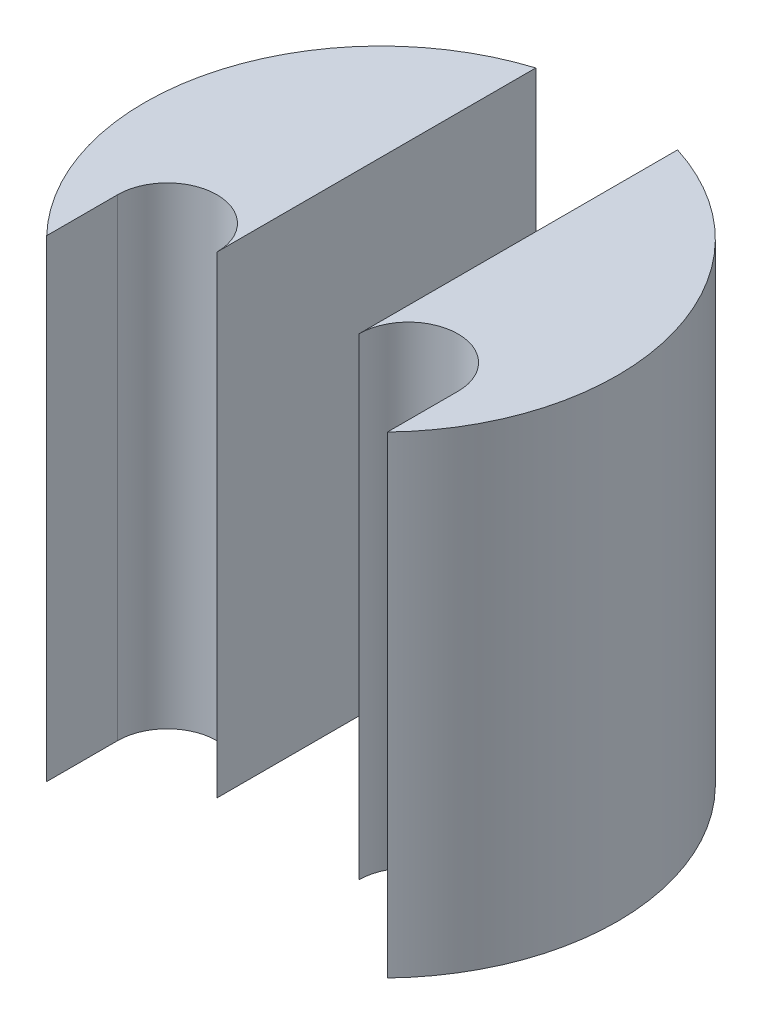
from build123d import *

# Parameters (mm, degrees)
BOSS_EXTRUDE2_DEPTH   = 200
BOSS_EXTRUDE2_2_DEPTH = 200


with BuildPart() as part:
    # Sketch2 → Boss-Extrude2 (new body)
    with BuildSketch(Plane(origin=(0, 0, 0), x_dir=(1, 0, 0), z_dir=(0, 1, 0))):
        with BuildLine():
            Line((-29.936750537, -39.462967992), (-29.936750537, 95.41378814))
            ThreePointArc((-29.936750537, 95.41378814), (-96.905308077, 24.685243904), (-71.936750537, -69.462967992))
            Line((-71.936750537, -69.462967992), (-71.936750537, -39.462967992))
            ThreePointArc((-71.936750537, -39.462967992), (-50.936750537, -18.462967992), (-29.936750537, -39.462967992))
        make_face()
    extrude(amount=BOSS_EXTRUDE2_DEPTH)


with BuildPart() as body_2:
    # Sketch2 → Boss-Extrude2 2 (new body)
    with BuildSketch(Plane(origin=(0, 0, 0), x_dir=(1, 0, 0), z_dir=(0, 1, 0))):
        with BuildLine():
            ThreePointArc((72.063249463, -69.331724894), (96.899173876, 24.709312052), (30.063249463, 95.374006059))
            Line((30.063249463, 95.374006059), (30.063249463, -39.462967992))
            ThreePointArc((30.063249463, -39.462967992), (51.063249463, -18.462967992), (72.063249463, -39.462967992))
            Line((72.063249463, -39.462967992), (72.063249463, -69.331724894))
        make_face()
    extrude(amount=BOSS_EXTRUDE2_2_DEPTH)


solid = Compound([part.part, body_2.part])
